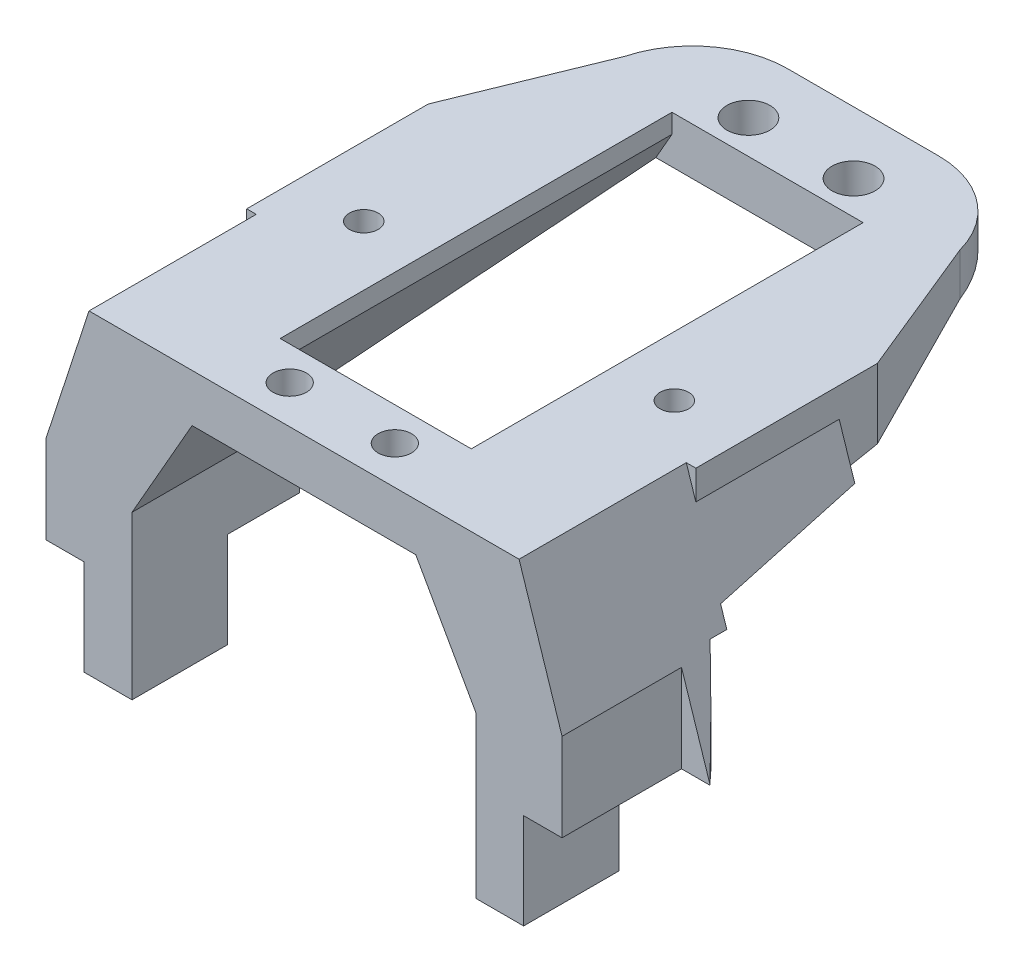
from build123d import *

# Parameters (mm, degrees)
SALIENTE_EXTRUIR1_DEPTH  = 35
CROQUIS6_R               = 2.25
CROQUIS6_W               = 20
CROQUIS6_H               = 25
CORTAR_EXTRUIR3_DEPTH    = 10
CROQUIS7_R               = 2.25
SALIENTE_EXTRUIR4_DEPTH  = 15
CORTAR_EXTRUIR8_DEPTH    = 50
CORTAR_EXTRUIR11_REACH   = 69.158
CORTAR_EXTRUIR12_DEPTH   = 16
CROQUIS13_W              = 6.081292266
CROQUIS13_H              = 9.753773429
CORTAR_EXTRUIR13_DEPTH   = 15
CORTAR_EXTRUIR14_DEPTH   = 63.5
CORTAR_EXTRUIR15_DEPTH   = 100
SALIENTE_EXTRUIR5_REACH  = 69.158
CROQUIS16_W              = 15
CROQUIS16_H              = 10
CORTAR_EXTRUIR16_DEPTH   = 200
CORTAR_EXTRUIR17_DEPTH   = 200
SALIENTE_EXTRUIR7_DEPTH  = 23.5
CROQUIS22_R              = 2.25
CORTAR_EXTRUIR19_DEPTH   = 47
CORTAR_EXTRUIR20_DEPTH   = 31
CROQUIS24_W              = 29.420485752
CROQUIS24_H              = 5
SALIENTE_EXTRUIR9_DEPTH  = 10
CROQUIS25_R              = 1.75
CROQUIS25_R_2            = 1.5
CORTAR_EXTRUIR21_DEPTH   = 5
CROQUIS26_W              = 58.407198467
CROQUIS26_H              = 13.689988589
CORTAR_EXTRUIR22_DEPTH   = 73.871462178
CROQUIS27_W              = 5
CROQUIS27_H              = 10
SALIENTE_EXTRUIR10_DEPTH = 10
CORTAR_EXTRUIR23_START   = -10
CORTAR_EXTRUIR23_DEPTH   = 10


# Read off the part's stored shape, not the designer's step: Cortar-Extruir23
with BuildPart() as part:
    # Croquis1 → Saliente-Extruir1 (new body)
    with BuildSketch(Plane.XY):
        Polygon((0, 0), (45, 0), (52.5, -23), (40.5, -23), (40.5, -16.192411456), (32.5, -2), (12.5, -2), (4.5, -16), (4.5, -23), (-7.5, -23), align=None)
    extrude(amount=SALIENTE_EXTRUIR1_DEPTH)

    # Croquis6 → Cortar-Extruir3 (cut)
    with BuildSketch(Plane(origin=(0, 0, 0), x_dir=(1, 0, 0), z_dir=(0, 1, 0))):
        with Locations(Location((17, -28.5, 0), (0, 0, 180))):
            Circle(CROQUIS6_R)
        with Locations(Location((28, -28.5, 0), (0, 0, 270))):
            Circle(CROQUIS6_R)
        with Locations((22.5, -12.5)):
            Rectangle(CROQUIS6_W, CROQUIS6_H)
    extrude(amount=-CORTAR_EXTRUIR3_DEPTH, mode=Mode.SUBTRACT)

    # Cortar-Extruir11: up to this plane
    cortar_extruir11_end = Plane(origin=(50, -15, 0), z_dir=(0, -0.9079593845004518, -0.41905817746174695))
    # Croquis11 → Cortar-Extruir11 (cut, up to the surface)
    with BuildSketch(Plane.XZ.offset(23), mode=Mode.PRIVATE) as cortar_extruir11_sk1:
        with BuildLine():
            Line((-7.5, 15), (-7.5, -3.030649644))
            Line((-7.5, -3.030649644), (52.5, -3.030649644))
            Line((52.5, -3.030649644), (52.5, 15))
            ThreePointArc((52.5, 15), (22.5, 5.553378231), (-7.5, 15))
        make_face()
    cortar_extruir11_tool1 = split(extrude(cortar_extruir11_sk1.sketch, amount=-CORTAR_EXTRUIR11_REACH, mode=Mode.PRIVATE), bisect_by=cortar_extruir11_end, keep=Keep.BOTH, mode=Mode.PRIVATE)
    add(cortar_extruir11_tool1.solids().sort_by_distance((22.5, -23, 3.105508))[0], mode=Mode.SUBTRACT)

    # Croquis13 → Cortar-Extruir13 (cut)
    with BuildSketch(Plane.XY.offset(35)):
        with Locations((-7.540646133, -18.123113286)):
            Rectangle(CROQUIS13_W, CROQUIS13_H)
        with Locations((52.540646133, -18.123113286)):
            Rectangle(CROQUIS13_W, CROQUIS13_H)
    extrude(amount=-CORTAR_EXTRUIR13_DEPTH, mode=Mode.SUBTRACT)

    # Croquis14 → Cortar-Extruir14 (cut, symmetric)
    with BuildSketch(Plane(origin=(0, 0, 0), x_dir=(0, 0, -1), z_dir=(1, 0, 0))):
        Polygon((-15, -11), (-15, -28.858785619), (26, -23), (26, -3), align=None)
    extrude(amount=CORTAR_EXTRUIR14_DEPTH, both=True, mode=Mode.SUBTRACT)

    # Saliente-Extruir5: up to this face of the body (flat: up to its plane)
    saliente_extruir5_end = Plane(part.part.faces().sort_by_distance((6.25, 0, 0.570087713))[0])
    # Croquis16 → Saliente-Extruir5 (add, up to the picked face)
    with BuildSketch(Plane.XZ.offset(23), mode=Mode.PRIVATE) as saliente_extruir5_sk1:
        with Locations((5, 40)):
            Rectangle(CROQUIS16_W, CROQUIS16_H)
    saliente_extruir5_tool1 = split(extrude(saliente_extruir5_sk1.sketch, amount=-SALIENTE_EXTRUIR5_REACH, mode=Mode.PRIVATE), bisect_by=saliente_extruir5_end, keep=Keep.BOTH, mode=Mode.PRIVATE)
    # Croquis16 → Saliente-Extruir5 (add, up to the picked face)
    with BuildSketch(Plane.XZ.offset(23), mode=Mode.PRIVATE) as saliente_extruir5_sk2:
        with Locations((40, 40)):
            Rectangle(CROQUIS16_W, CROQUIS16_H)
    saliente_extruir5_tool2 = split(extrude(saliente_extruir5_sk2.sketch, amount=-SALIENTE_EXTRUIR5_REACH, mode=Mode.PRIVATE), bisect_by=saliente_extruir5_end, keep=Keep.BOTH, mode=Mode.PRIVATE)
    add(saliente_extruir5_tool1.solids().sort_by(Axis((5, -23, 40), (0, 1, 0)))[0])
    add(saliente_extruir5_tool2.solids().sort_by(Axis((40, -23, 40), (0, 1, 0)))[0])

    # Croquis17 → Cortar-Extruir16 (cut)
    with BuildSketch(Plane.ZY.offset(2.5)):
        Polygon((35, 0), (45, -23), (45, 0), align=None)
    extrude(amount=-CORTAR_EXTRUIR16_DEPTH, mode=Mode.SUBTRACT)

    # Croquis18 → Cortar-Extruir17 (cut)
    with BuildSketch(Plane(origin=(0, 0, 35), x_dir=(-1, 0, 0), z_dir=(0, 0, -1))):
        Polygon((-32.5, -2), (-40.5, -16.192411456), (-40.5, -23), (-32.5, -23), align=None)
        Polygon((-12.5, -23), (-4.5, -23), (-4.5, -16), (-12.5, -2), align=None)
        Polygon((-47.5, -7.666666667), (-45, 0), (-47.5, 0), align=None)
        Polygon((2.5, 0), (0, 0), (2.5, -7.666666667), align=None)
    extrude(amount=-CORTAR_EXTRUIR17_DEPTH, mode=Mode.SUBTRACT)



with BuildPart() as body_2:
    # Croquis7 → Saliente-Extruir4 (new body)
    with BuildSketch(Plane(origin=(0, 0, 0), x_dir=(1, 0, 0), z_dir=(0, 1, 0))):
        with BuildLine():
            Line((12.5, 16), (32.5, 16))
            Line((32.5, 16), (32.5, 0))
            Line((32.5, 0), (45, 0))
            Line((45, 0), (40.044296858, 18.577458823))
            ThreePointArc((40.044296858, 18.577458823), (36.474189304, 23.930150952), (30.382169451, 26))
            Line((30.382169451, 26), (14.617830549, 26))
            ThreePointArc((14.617830549, 26), (8.525810696, 23.930150952), (4.955703142, 18.577458823))
            Line((4.955703142, 18.577458823), (0, 0))
            Line((0, 0), (12.5, 0))
            Line((12.5, 0), (12.5, 16))
        make_face()
        with Locations((28, 19.5)):
            Circle(CROQUIS7_R, mode=Mode.SUBTRACT)
        with Locations((17, 19.5)):
            Circle(CROQUIS7_R, mode=Mode.SUBTRACT)
    extrude(amount=-SALIENTE_EXTRUIR4_DEPTH)

    # Croquis10 → Cortar-Extruir8 (cut)
    with BuildSketch(Plane(origin=(0, 0, 0), x_dir=(0, 0, -1), z_dir=(1, 0, 0))):
        Polygon((0, -15), (26, -3), (26, 0), (28.244981963, 0), (28.244981963, -21.856093693), align=None)
    extrude(amount=CORTAR_EXTRUIR8_DEPTH, mode=Mode.SUBTRACT)

    # Croquis12 → Cortar-Extruir12 (cut)
    with BuildSketch(Plane.XY):
        Polygon((12.5, -2), (12.5, -7.5), (12.5, -22.325980529), (0.885153984, -22.325980529), align=None)
        Polygon((44.114846016, -22.325980529), (32.5, -22.325980529), (32.5, -7.5), (32.5, -2), align=None)
    extrude(amount=-CORTAR_EXTRUIR12_DEPTH, mode=Mode.SUBTRACT)

    # Croquis15 → Cortar-Extruir15 (cut, symmetric)
    with BuildSketch(Plane(origin=(0, 0, 0), x_dir=(0, 0, -1), z_dir=(1, 0, 0))):
        Polygon((-15, -23), (-15, -11), (26, -3), align=None)
    extrude(amount=CORTAR_EXTRUIR15_DEPTH, both=True, mode=Mode.SUBTRACT)


with BuildPart() as part_1:
    add(part.part)

    add(body_2.part)  # Saliente-Extruir7 merges body 2
    # Croquis20 → Saliente-Extruir7 (add, symmetric)
    with BuildSketch(Plane(origin=(22.5, 0, 0), x_dir=(0, 0, -1), z_dir=(1, 0, 0))):
        Polygon((-15, -11), (-15, 0), (26, 0), (26, -3), align=None)
    extrude(amount=SALIENTE_EXTRUIR7_DEPTH, both=True)

    # Croquis22 → Cortar-Extruir19 (cut)
    with BuildSketch(Plane(origin=(0, 0, 0), x_dir=(1, 0, 0), z_dir=(0, 1, 0))):
        with Locations(Location((17, 19.5, 0), (0, 0, 180))):
            Circle(CROQUIS22_R)
        with Locations(Location((28, 19.5, 0), (0, 0, 180))):
            Circle(CROQUIS22_R)
        Polygon((12.5, 0), (12.5, -25), (32.5, -25), (32.5, 0), (32.5, 16), (12.5, 16), align=None)
        with BuildLine():
            Line((4.955703142, 18.577458823), (-2.632555673, 0))
            Line((-2.632555673, 0), (-11.688532454, 0))
            Line((-11.688532454, 0), (-11.688532454, 31.257495622))
            Line((-11.688532454, 31.257495622), (0, 31.257495622))
            Line((0, 31.257495622), (45, 31.257495622))
            Line((45, 31.257495622), (54.896993635, 31.257495622))
            Line((54.896993635, 31.257495622), (58.873924375, 0))
            Line((58.873924375, 0), (47.632555673, 0))
            Line((47.632555673, 0), (40.044296858, 18.577458823))
            ThreePointArc((40.044296858, 18.577458823), (36.474189304, 23.930150952), (30.382169451, 26))
            Line((30.382169451, 26), (14.617830549, 26))
            ThreePointArc((14.617830549, 26), (8.525810696, 23.930150952), (4.955703142, 18.577458823))
        make_face()
    extrude(amount=-CORTAR_EXTRUIR19_DEPTH, mode=Mode.SUBTRACT)

    # Croquis23 → Cortar-Extruir20 (cut)
    with BuildSketch(Plane.XY.offset(15)):
        Polygon((7.357142857, -11), (12.5, -11), (12.5, -2), align=None)
        Polygon((37.573133641, -11), (32.5, -2), (32.5, -11), align=None)
    extrude(amount=-CORTAR_EXTRUIR20_DEPTH, mode=Mode.SUBTRACT)

    # Croquis24 → Saliente-Extruir9 (add)
    with BuildSketch(Plane.XY.offset(35)):
        with Locations((22.884581513, -2.5)):
            Rectangle(CROQUIS24_W, CROQUIS24_H)
    extrude(amount=-SALIENTE_EXTRUIR9_DEPTH)

    # Croquis25 → Cortar-Extruir21 (cut)
    with BuildSketch(Plane(origin=(0, 0, 0), x_dir=(1, 0, 0), z_dir=(0, 1, 0))):
        with Locations(Location((17, -28.5, 0), (0, 0, 180))):
            Circle(CROQUIS25_R)
        with Locations((28, -28.5)):
            Circle(CROQUIS25_R)
        with Locations(Location((6.253029256, -10.000000184, 0), (0, 0, 180))):
            Circle(CROQUIS25_R_2)
        with Locations((38.746970744, -10.000000184)):
            Circle(CROQUIS25_R_2)
    extrude(amount=-CORTAR_EXTRUIR21_DEPTH, mode=Mode.SUBTRACT)

    # Croquis26 → Cortar-Extruir22 (cut, through all)
    with BuildSketch(Plane(origin=(0, 0, 0), x_dir=(1, 0, 0), z_dir=(0, 1, 0))):
        with Locations((24.703599234, -39.344994294)):
            Rectangle(CROQUIS26_W, CROQUIS26_H)
    extrude(amount=-CORTAR_EXTRUIR22_DEPTH, mode=Mode.SUBTRACT)

    # Croquis27 → Saliente-Extruir10 (add)
    with BuildSketch(Plane.XZ.offset(23)):
        with Locations((2, 27.5)):
            Rectangle(CROQUIS27_W, CROQUIS27_H)
        with Locations((42.976758833, 27.5)):
            Rectangle(CROQUIS27_W, CROQUIS27_H)
    extrude(amount=SALIENTE_EXTRUIR10_DEPTH)

    # Cortar-Extruir23 outline → Cortar-Extruir23 (cut)
    with BuildSketch(Plane.XZ.offset(23).offset(CORTAR_EXTRUIR23_START)):
        with BuildLine():
            ThreePointArc((-2.152586071, 15), (-4.921729811, 17.378723686), (-7.462476533, 20))
            Line((-7.462476533, 20), (-9, 21.738415502))
            Line((-9, 21.738415502), (-9, 15))
            Line((-9, 15), (-2.152586071, 15))
        make_face()
        with BuildLine():
            ThreePointArc((52.462476533, 20), (49.921729811, 17.378723686), (47.152586071, 15))
            Line((47.152586071, 15), (54, 15))
            Line((54, 15), (54, 21.738415502))
            Line((54, 21.738415502), (52.462476533, 20))
        make_face()
    extrude(amount=CORTAR_EXTRUIR23_DEPTH, mode=Mode.SUBTRACT)


solid = part_1.part
